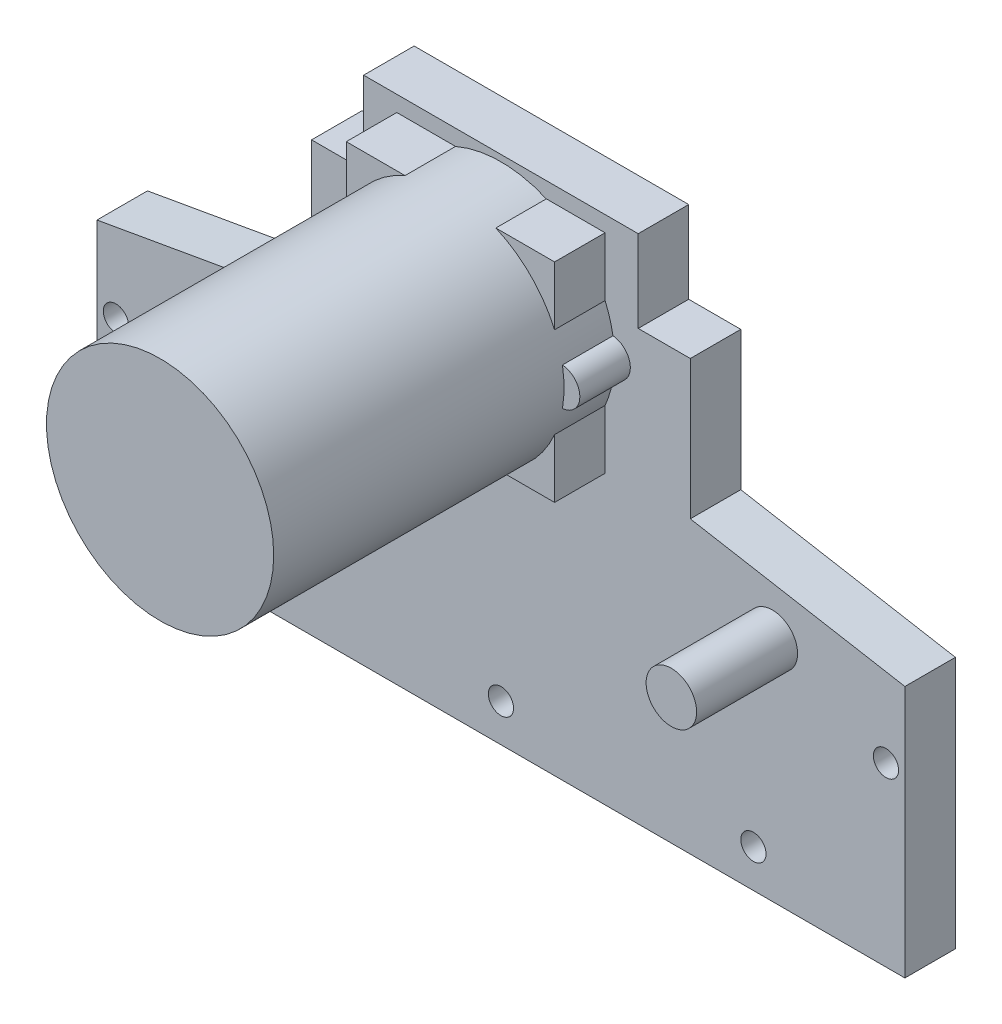
from build123d import *

# Parameters (mm, degrees)
BOSS_EXTRUDE1_DEPTH = 4
SKETCH2_R           = 1
CUT_EXTRUDE1_DEPTH  = 5
SKETCH3_R           = 9
BOSS_EXTRUDE2_DEPTH = 27
SKETCH5_W           = 18
SKETCH5_H           = 18
BOSS_EXTRUDE3_DEPTH = 3
SKETCH6_R           = 2
BOSS_EXTRUDE4_DEPTH = 8
SKETCH7_R           = 1.5
SKETCH7_W           = 16.5
SKETCH7_H           = 16.5
BOSS_EXTRUDE5_DEPTH = 4


with BuildPart() as part:
    # Sketch1 → Boss-Extrude1 (new body)
    with BuildSketch(Plane.XY):
        Polygon((-32, 20), (-32, 0), (32, 0), (32, 20), (15, 23), (15, 34), (10.875, 34), (10.875, 40.5), (-10.875, 40.5), (-10.875, 34), (-15, 34), (-15, 23), align=None)
    extrude(amount=BOSS_EXTRUDE1_DEPTH)

    # Sketch2 → Cut-Extrude1 (cut)
    with BuildSketch(Plane.XY.offset(4)):
        with Locations((20, 3)):
            Circle(SKETCH2_R)
        with Locations((0, 3)):
            Circle(SKETCH2_R)
        with Locations((-20, 3)):
            Circle(SKETCH2_R)
        with Locations((-30.5, 14)):
            Circle(SKETCH2_R)
        with Locations((30.5, 14)):
            Circle(SKETCH2_R)
    extrude(amount=-CUT_EXTRUDE1_DEPTH, mode=Mode.SUBTRACT)

    # Sketch3 → Boss-Extrude2 (add)
    with BuildSketch(Plane.XY.offset(4)):
        with Locations((0, 31)):
            Circle(SKETCH3_R)
    extrude(amount=BOSS_EXTRUDE2_DEPTH)

    # Sketch5 → Boss-Extrude3 (add)
    with BuildSketch(Plane(origin=(0, 0, 0), x_dir=(-1, 0, 0), z_dir=(0, 0, -1))):
        with Locations((4, 19)):
            Rectangle(SKETCH5_W, SKETCH5_H)
    extrude(amount=BOSS_EXTRUDE3_DEPTH)

    # Sketch6 → Boss-Extrude4 (add)
    with BuildSketch(Plane.XY.offset(4)):
        with Locations((21.5, 18)):
            Circle(SKETCH6_R)
        with Locations((-21.5, 18)):
            Circle(SKETCH6_R)
    extrude(amount=BOSS_EXTRUDE4_DEPTH)

    # Sketch7 → Boss-Extrude5 (add)
    with BuildSketch(Plane.XY.offset(4)):
        with Locations((-8.75, 31)):
            Circle(SKETCH7_R)
        with Locations((8.75, 31)):
            Circle(SKETCH7_R)
        with Locations((0, 31)):
            Rectangle(SKETCH7_W, SKETCH7_H)
    extrude(amount=BOSS_EXTRUDE5_DEPTH)


solid = part.part
